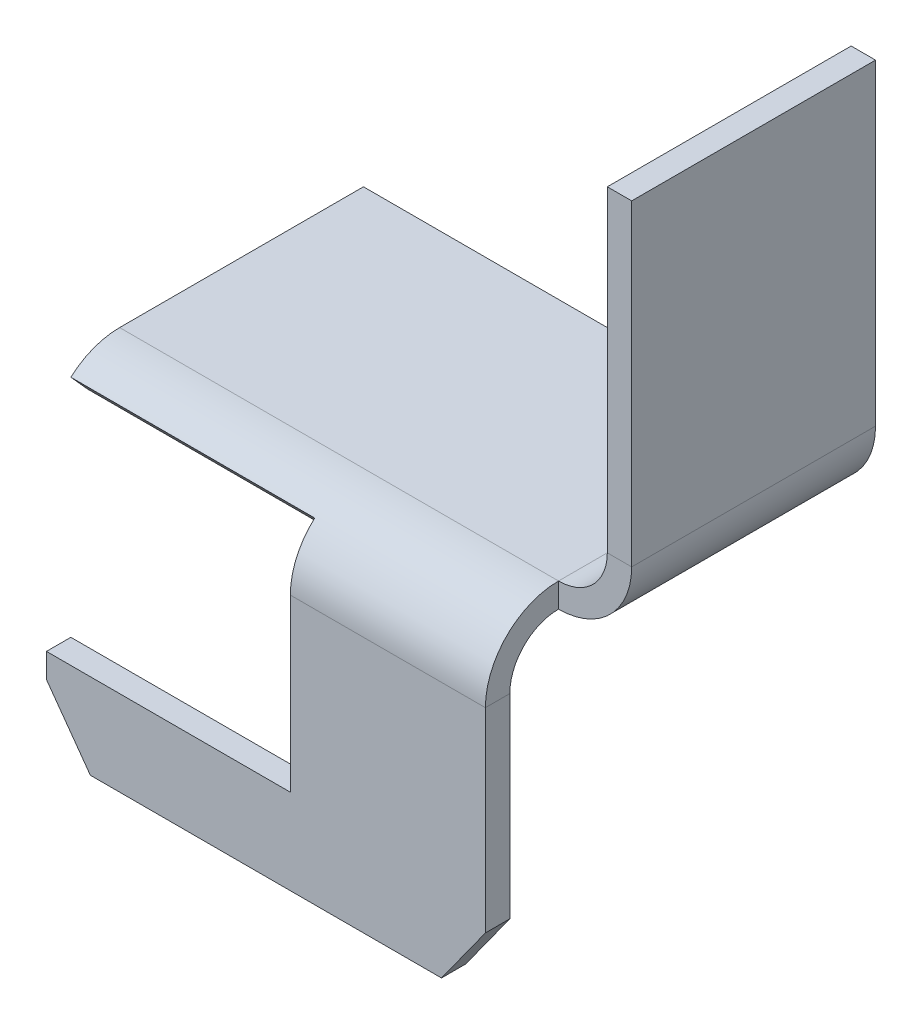
from build123d import *

# Parameters (mm, degrees)
SM_BASE_FLANGE_1_DEPTH      = 10
SM_EDGE_FLANGE_2_DEPTH      = 18
SM_START                    = 1
SM_EDGE_FLANGE_2_FLAT_DEPTH = 1
SKETCH_10_W                 = 40
SKETCH_10_H                 = 40
CUT_EXTRUDE_1_DEPTH         = 29.460498942
SMNORMALCUT_DEPTH           = 10


# Read off the part's stored shape, not the designer's step: SMNormalCut
# Sheet-metal steps are written as plain solids
with BuildPart() as part:
    # Sketch 1 → 基体-法兰1 (new body)
    with BuildSketch(Plane.XY):
        with BuildLine():
            Line((0, 0), (18, 0))
            ThreePointArc((18, 0), (19.414213562, 0.585786438), (20, 2))
            Line((20, 2), (20, 15))
            Line((20, 15), (21, 15))
            Line((21, 15), (21, 2))
            ThreePointArc((21, 2), (20.121320344, -0.121320344), (18, -1))
            Line((18, -1), (0, -1))
            Line((0, -1), (0, 0))
        make_face()
    extrude(amount=SM_BASE_FLANGE_1_DEPTH)

    # 边线-法兰2 bend section (across the edge) → 边线-法兰2 (add)
    with BuildSketch(Plane(origin=(18, -1, 12), x_dir=(0, 0, -1), z_dir=(-1, 0, 0))):
        with BuildLine():
            Line((-1, 2), (0, 2))
            ThreePointArc((0, 2), (0.585786438, 0.585786438), (2, 0))
            Line((2, 0), (2, -1))
            ThreePointArc((2, -1), (-0.121320344, -0.121320344), (-1, 2))
        make_face()
    extrude(amount=SM_EDGE_FLANGE_2_DEPTH)

    # 边线-法兰2 profile (on flange) → 边线-法兰2 flat (add)
    with BuildSketch(Plane(origin=(0, -1, 12), x_dir=(-1, 0, 0), z_dir=(0, 0, 1)).offset(SM_START)):
        Polygon((0, 2), (0, 10), (-1.8, 12.5), (-16.2, 12.5), (-18, 10), (-18, 2), align=None)
    extrude(amount=-SM_EDGE_FLANGE_2_FLAT_DEPTH)

    # 草图10 → 切除-拉伸1 (cut, through all)
    with BuildSketch(Plane(origin=(0, 0, 12), x_dir=(-1, 0, 0), z_dir=(0, 0, -1))):
        with Locations((10, 10)):
            Rectangle(SKETCH_10_W, SKETCH_10_H)
    extrude(amount=-CUT_EXTRUDE_1_DEPTH, mode=Mode.SUBTRACT)

    # SMNormalCut outline → SMNormalCut (cut)
    with BuildSketch(Plane.YZ):
        with BuildLine():
            ThreePointArc((-3, 12), (-2.183503419, 11.825741858), (-1.509288015, 11.333333333))
            Line((-1.509288015, 11.333333333), (-0.763932023, 12))
            Line((-0.763932023, 12), (-3, 12))
        make_face()
    extrude(amount=SMNORMALCUT_DEPTH, mode=Mode.SUBTRACT)


solid = part.part
